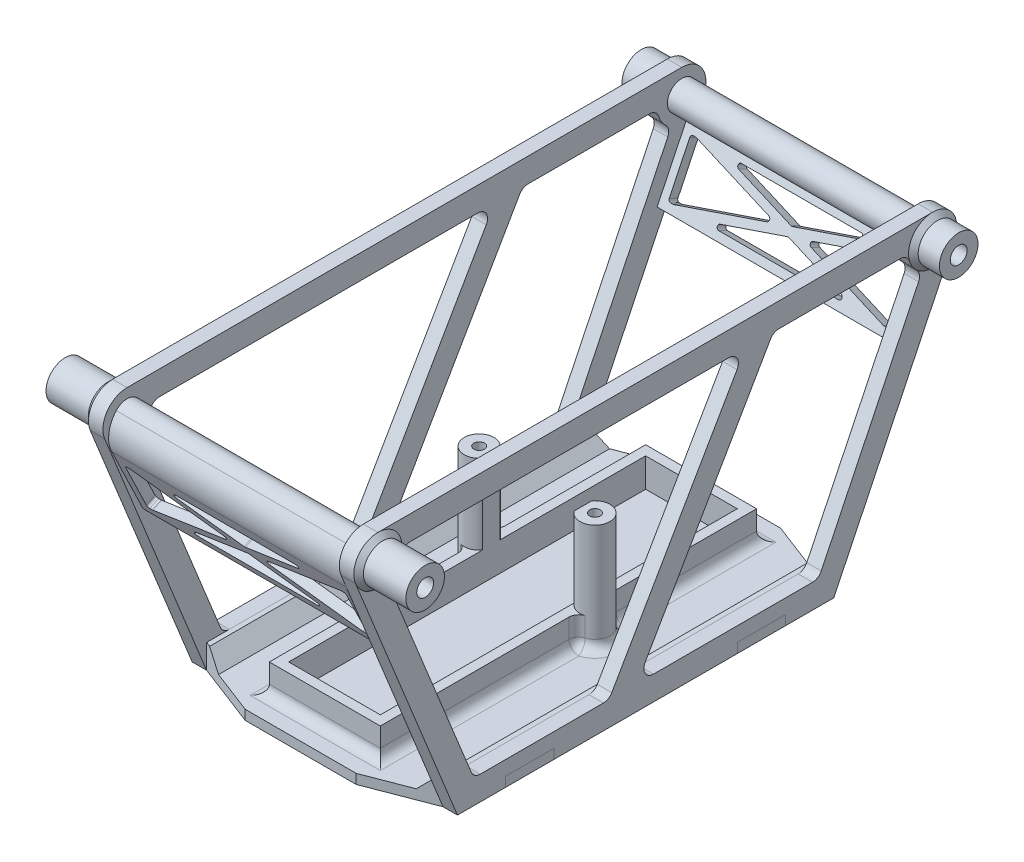
from build123d import *

# Parameters (mm, degrees)
MOTOR_START                      = -14
MOTOR_BOX_SKETCH_W               = 19
MOTOR_BOX_SKETCH_H               = 74
MOTOR_BOX_SKETCH_R               = 1.1
MOTOR_BOX_EXTRUDE_DEPTH          = 8
MOTOR_BOX_SKETCH_3_R             = 1.1
MOTOR_RISER_EXTRUDE_DEPTH        = 24.5
RIGHT_WALL_SKETCH_R              = 1.15
RIGHT_WALL_EXTRUDE_DEPTH         = 3
SKETCH6_R                        = 4
SKETCH6_R_2                      = 1.75
FRONT_JOINT_RISER_EXTRUDE_DEPTH  = 9.8
SKETCH6_3_R                      = 4
SKETCH6_3_R_2                    = 1.75
REAR_JOINT_RISER_EXTRUDE_DEPTH   = 5.4
RIGHT_WALL_FILLET_R              = 2
RISER_FILLET_SIZE                = 1
BOTTOM_PLATE_EXTRUDE_DEPTH       = 2
BOX_FILLET_R                     = 2
BASE_PLATE_CHAMFER_EXTRUDE_DEPTH = 3
BASE_PLATE_CHAMFER_SIZE          = 3
SKETCH8_R                        = 1.15
BOSS_EXTRUDE1_DEPTH              = 49
FILLET1_R                        = 1
CUT_EXTRUDE1_DEPTH               = 10
FILLET2_R                        = 0.5


with BuildPart() as part:
    # Motor Box Sketch → Motor Box Extrude (new body)
    with BuildSketch(Plane(origin=(0, 0, 0), x_dir=(1, 0, 0), z_dir=(0, 1, 0)).offset(MOTOR_START)):
        with BuildLine():
            Line((11.5, 14.5), (-11.5, 14.5))
            Line((-11.5, 14.5), (-11.5, -16.440588292))
            ThreePointArc((-11.5, -16.440588292), (-15.1, -19.5), (-11.5, -22.559411708))
            Line((-11.5, -22.559411708), (-11.5, -63.5))
            Line((-11.5, -63.5), (11.5, -63.5))
            Line((11.5, -63.5), (11.5, -22.559411708))
            ThreePointArc((11.5, -22.559411708), (15.1, -19.5), (11.5, -16.440588292))
            Line((11.5, -16.440588292), (11.5, 14.5))
        make_face()
        with Locations((0, -24.5)):
            Rectangle(MOTOR_BOX_SKETCH_W, MOTOR_BOX_SKETCH_H, mode=Mode.SUBTRACT)
        with Locations(Location((-12, -19.5, 0), (0, 0, 270))):
            Circle(MOTOR_BOX_SKETCH_R, mode=Mode.SUBTRACT)
        with Locations(Location((12, -19.5, 0), (0, 0, 270))):
            Circle(MOTOR_BOX_SKETCH_R, mode=Mode.SUBTRACT)
    extrude(amount=MOTOR_BOX_EXTRUDE_DEPTH)

    # Motor Box Sketch<3> → Motor Riser Extrude (add)
    # profile 1 of 2: a face of its own
    with BuildSketch(Plane(origin=(0, 0, 0), x_dir=(1, 0, 0), z_dir=(0, 1, 0)).offset(MOTOR_START)):
        with BuildLine():
            ThreePointArc((11.5, -22.559411708), (15.1, -19.5), (11.5, -16.440588292))
            ThreePointArc((11.5, -16.440588292), (10.379505368, -16.857274674), (9.5, -17.666969722))
            Line((9.5, -17.666969722), (9.5, -21.333030278))
            ThreePointArc((9.5, -21.333030278), (10.379505368, -22.142725326), (11.5, -22.559411708))
        make_face()
        with Locations(Location((12, -19.5, 0), (0, 0, 270))):
            Circle(MOTOR_BOX_SKETCH_3_R, mode=Mode.SUBTRACT)
    # profile 2 of 2: a face of its own
    with BuildSketch(Plane(origin=(0, 0, 0), x_dir=(1, 0, 0), z_dir=(0, 1, 0)).offset(MOTOR_START)):
        with BuildLine():
            ThreePointArc((-9.5, -17.666969722), (-10.379505368, -16.857274674), (-11.5, -16.440588292))
            ThreePointArc((-11.5, -16.440588292), (-15.1, -19.5), (-11.5, -22.559411708))
            ThreePointArc((-11.5, -22.559411708), (-10.379505368, -22.142725326), (-9.5, -21.333030278))
            Line((-9.5, -21.333030278), (-9.5, -17.666969722))
        make_face()
        with Locations(Location((-12, -19.5, 0), (0, 0, 270))):
            Circle(MOTOR_BOX_SKETCH_3_R, mode=Mode.SUBTRACT)
    extrude(amount=MOTOR_RISER_EXTRUDE_DEPTH)

    # Bottom Plate Sketch → Bottom Plate Extrude (add)
    with BuildSketch(Plane.XZ.offset(14)):
        Polygon((24.5, -4.5), (24.5, -14.5), (11.5, -19.5), (-11.5, -19.5), (-24.5, -14.5), (-24.5, -4.5), (-27.5, -4.5), (-27.5, 5.5), (-24.5, 5.5), (-24.5, 43.5), (-27.5, 43.5), (-27.5, 53.5), (-24.5, 53.5), (-24.5, 63.5), (-11.5, 68.5), (11.5, 68.5), (24.5, 63.5), (24.5, 53.5), (27.5, 53.5), (27.5, 43.5), (24.5, 43.5), (24.5, 5.5), (27.5, 5.5), (27.5, -4.5), align=None)
    extrude(amount=-BOTTOM_PLATE_EXTRUDE_DEPTH)

    # Box Fillet
    box_fillet_edges = [part.edges().sort_by_distance(p)[0] for p in [
        (-11.5, -12, 43.029705854),
        (-15.1, -12, 19.5),
        (-11.5, -12, 0.970294146),
        (0, -12, -14.5),
        (15.1, -12, 19.5),
        (0, -12, 63.5),
        (11.5, -12, 43.029705854),
        (11.5, -12, 0.970294146),
        (-11.5, -9, 16.440588292),
        (11.5, -9, 16.440588292),
        (11.5, -9, 22.559411708),
        (-11.5, -9, 22.559411708),
    ]]
    fillet(box_fillet_edges, radius=BOX_FILLET_R)

    # Sketch7 → Base Plate Chamfer Extrude (add)
    with BuildSketch(Plane(origin=(0, -12, 0), x_dir=(1, 0, 0), z_dir=(0, 1, 0))):
        Polygon((20.5, 16.038461538), (20.5, -65.038461538), (24.5, -63.5), (24.5, -53.5), (24.5, -43.5), (24.5, -5.5), (24.5, 4.5), (24.5, 14.5), align=None)
        Polygon((-20.5, -65.038461538), (-20.5, 16.038461538), (-24.5, 14.5), (-24.5, 4.5), (-24.5, -5.5), (-24.5, -43.5), (-24.5, -53.5), (-24.5, -63.5), align=None)
    extrude(amount=BASE_PLATE_CHAMFER_EXTRUDE_DEPTH)

    # Base Plate Chamfer
    base_plate_chamfer_edges = [part.edges().sort_by_distance(p)[0] for p in [
        (-20.5, -9, 24.5),
        (20.5, -9, 24.5),
    ]]
    chamfer(base_plate_chamfer_edges, length=BASE_PLATE_CHAMFER_SIZE - 0.0001)  # a hair under: the kernel refuses the full size


with BuildPart() as body_2:
    # Right Wall Sketch → Right Wall Extrude (new body)
    with BuildSketch(Plane(origin=(-27.5, 0, 0), x_dir=(0, 0, -1), z_dir=(1, 0, 0))):
        with BuildLine():
            Line((35, 45), (-80, 45))
            ThreePointArc((-80, 45), (-84.146921376, 42.793392759), (-84.633592057, 38.121217242))
            Line((-84.633592057, 38.121217242), (-63.5, -14))
            Line((-63.5, -14), (-53.5, -14))
            Line((-53.5, -14), (-53.5, -12))
            Line((-53.5, -12), (-43.5, -12))
            Line((-43.5, -12), (-43.5, -14))
            Line((-43.5, -14), (-5.5, -14))
            Line((-5.5, -14), (-5.5, -12))
            Line((-5.5, -12), (4.5, -12))
            Line((4.5, -12), (4.5, -14))
            Line((4.5, -14), (14.5, -14))
            Line((14.5, -14), (39.503329995, 37.827439539))
            ThreePointArc((39.503329995, 37.827439539), (39.234548518, 42.658683668), (35, 45))
        make_face()
        with Locations((35, 40)):
            Circle(RIGHT_WALL_SKETCH_R, mode=Mode.SUBTRACT)
        with Locations((-80, 40)):
            Circle(RIGHT_WALL_SKETCH_R, mode=Mode.SUBTRACT)
        with BuildLine():
            Line((32.827439539, 35.496670005), (11.360723573, -9))
            Line((11.360723573, -9), (-26.324314261, -9))
            Line((-26.324314261, -9), (1.965848929, 40))
            Line((1.965848929, 40), (30, 40))
            ThreePointArc((30, 40), (30.765451482, 37.341316332), (32.827439539, 35.496670005))
        make_face(mode=Mode.SUBTRACT)
        with BuildLine():
            Line((-75, 40), (-3.807653763, 40))
            Line((-3.807653763, 40), (-32.097816953, -9))
            Line((-32.097816953, -9), (-60.131968024, -9))
            Line((-60.131968024, -9), (-78.121217242, 35.366407943))
            ThreePointArc((-78.121217242, 35.366407943), (-75.853078624, 37.206607241), (-75, 40))
        make_face(mode=Mode.SUBTRACT)
    extrude(amount=RIGHT_WALL_EXTRUDE_DEPTH)

    # Sketch6 → Front Joint Riser Extrude (add)
    with BuildSketch(Plane.ZY.offset(27.5)):
        with Locations(Location((80, 40, 0), (0, 0, 180))):
            Circle(SKETCH6_R)
        with Locations((80, 40)):
            Circle(SKETCH6_R_2, mode=Mode.SUBTRACT)
    extrude(amount=FRONT_JOINT_RISER_EXTRUDE_DEPTH)

    # Sketch6<3> → Rear Joint Riser Extrude (add)
    with BuildSketch(Plane.ZY.offset(27.5)):
        with Locations(Location((-35, 40, 0), (0, 0, 180))):
            Circle(SKETCH6_3_R)
        with Locations((-35, 40)):
            Circle(SKETCH6_3_R_2, mode=Mode.SUBTRACT)
    extrude(amount=REAR_JOINT_RISER_EXTRUDE_DEPTH)

    # Right Wall Fillet
    right_wall_fillet_edges = [body_2.edges().sort_by_distance(p)[0] for p in [
        (-26, 35.496670005, -32.827439539),
        (-26, 40, -30),
        (-26, 40, -1.965848929),
        (-26, -9, 26.324314261),
        (-26, -9, -11.360723573),
        (-26, -9, 32.097816953),
        (-26, 40, 3.807653763),
        (-26, 40, 75),
        (-26, 35.366407943, 78.121217242),
        (-26, -9, 60.131968024),
    ]]
    fillet(right_wall_fillet_edges, radius=RIGHT_WALL_FILLET_R)

    # Riser Fillet
    riser_fillet_edges = [body_2.edges().sort_by_distance(p)[0] for p in [
        (-27.5, 40, 84),
        (-27.5, 40, -31),
    ]]
    chamfer(riser_fillet_edges, length=RISER_FILLET_SIZE - 0.0001)  # a hair under: the kernel refuses the full size


with BuildPart() as body_3:
    # Left Wall Mirror: mirrored copy
    add(body_2.part.mirror(Plane(origin=(0, 0, 0), x_dir=(0, 0, 1), z_dir=(1, 0, 0))))


with BuildPart() as body_4:
    # Sketch8 → Boss-Extrude1 (new body)
    # profile 1 of 2: a face of its own
    with BuildSketch(Plane(origin=(-24.5, 0, 0), x_dir=(0, 0, -1), z_dir=(1, 0, 0))):
        with BuildLine():
            Line((36.39846172, 35.994465726), (33.696463723, 37.298002003))
            ThreePointArc((33.696463723, 37.298002003), (32.606117475, 41.808127887), (37.242494254, 41.992791891))
            ThreePointArc((37.242494254, 41.992791891), (38.760777177, 38.704040194), (38.199793718, 35.125441542))
            Line((38.199793718, 35.125441542), (36.39846172, 35.994465726))
        make_face()
        with Locations(Location((35, 40, 0), (0, 0, 180))):
            Circle(SKETCH8_R, mode=Mode.SUBTRACT)
    # profile 2 of 2: a face of its own
    with BuildSketch(Plane(origin=(-24.5, 0, 0), x_dir=(0, 0, -1), z_dir=(1, 0, 0))):
        Polygon((29.880780337, 22.484475742), (31.682112335, 21.615451557), (38.199793718, 35.125441542), (36.39846172, 35.994465726), align=None)
    extrude(amount=BOSS_EXTRUDE1_DEPTH)

    # Fillet1
    fillet1_edges = [body_4.edges().sort_by_distance(p)[0] for p in [
        (0, 35.994465726, -36.39846172),
    ]]
    fillet(fillet1_edges, radius=FILLET1_R)

    # Sketch9 → Cut-Extrude1 (cut)
    with BuildSketch(Plane(origin=(0, -7.448765312, -15.439960753), x_dir=(1, 0, 0), z_dir=(0, 0.4345120922069147, 0.9006659989840684))):
        Polygon((15.987956044, 45.634563187), (-15.987956044, 45.634563187), (0, 41.066575745), align=None)
        Polygon((-22.9, 34.834563187), (-22.9, 45.634563187), (-21.812043956, 45.634563187), (-2.912043956, 40.234563187), (-21.812043956, 34.834563187), align=None)
        Polygon((21.812043956, 45.634563187), (2.912043956, 40.234563187), (21.812043956, 34.834563187), (22.9, 34.834563187), (22.9, 45.634563187), align=None)
        Polygon((0, 39.402550628), (15.987956044, 34.834563187), (-15.987956044, 34.834563187), align=None)
    extrude(amount=-CUT_EXTRUDE1_DEPTH, mode=Mode.SUBTRACT)

    # Fillet2
    fillet2_edges = [body_4.edges().sort_by_distance(p)[0] for p in [
        (15.987956044, 23.491029248, -31.476665684),
        (-15.987956044, 23.491029248, -31.476665684),
        (0, 27.60526022, -33.461511464),
        (-15.987956044, 33.218222037, -36.16939628),
        (15.987956044, 33.218222037, -36.16939628),
        (0, 29.103991065, -34.184550499),
        (22.9, 33.218222037, -36.16939628),
        (22.9, 23.491029248, -31.476665684),
        (21.812043956, 23.491029248, -31.476665684),
        (2.912043956, 28.354625642, -33.823030982),
        (-21.812043956, 23.491029248, -31.476665684),
        (-22.9, 23.491029248, -31.476665684),
        (-22.9, 33.218222037, -36.16939628),
        (-21.812043956, 33.218222037, -36.16939628),
        (-2.912043956, 28.354625642, -33.823030982),
    ]]
    fillet(fillet2_edges, radius=FILLET2_R)


with BuildPart() as body_5:
    # Mirror1: mirrored copy
    add(body_4.part.mirror(Plane.XY.offset(22.5)))


solid = Compound([part.part, body_2.part, body_3.part, body_4.part, body_5.part])
